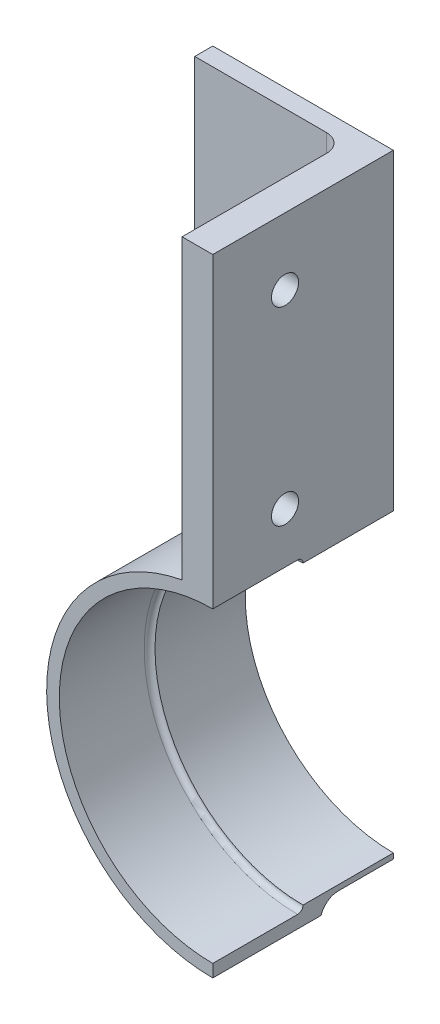
from build123d import *

# Parameters (mm, degrees)
BOSS_EXTRUDE1_DEPTH     = 2.5399999999999996
BOSS_EXTRUDE3_DEPTH     = 12.7
BOSS_EXTRUDE6_DEPTH     = 2.54
BOSS_EXTRUDE7_DEPTH     = 25.4
BOSS_EXTRUDE8_START     = 10.16
BOSS_EXTRUDE8_DEPTH     = 15.239999999999998
FILLET1_R               = 2.5399999999999996
FILLET2_ANGLE           = 169.351542
FILLET3_R               = 0.762
CUT_EXTRUDE1_DEPTH      = 93.8296161634462
CUT_EXTRUDE1_DEPTH_BACK = 93.8296161634462
SKETCH3_R               = 1.9050000000000038
SKETCH3_R_2             = 1.9049999999999983


with BuildPart() as part:
    # Sketch2 → Boss-Extrude1 (new body)
    with BuildSketch(Plane.XY):
        with BuildLine():
            Line((0, 85.598), (0, 0))
            Line((0, 0), (14.804819963776673, 1e-17))
            ThreePointArc((14.804819963776595, -3.0553e-13), (2.268412192290537, 24.14357981267628), (21.081999999999496, 43.793589476431805))
            Line((21.082000000000004, 43.79358947643172), (21.082, 85.598))
            Line((21.082, 85.598), (0, 85.598))
        make_face()
    extrude(amount=BOSS_EXTRUDE1_DEPTH)



with BuildPart() as body_2:
    # Sketch2<4> → Boss-Extrude3 (new body)
    with BuildSketch(Plane.XY):
        with BuildLine():
            ThreePointArc((21.082000000000008, 41.98179341867554), (3.82144132339004, 21.53078406363614), (19.714710561456986, 2.0606e-13))
            Line((19.714710561456965, 2e-17), (25.399999983196594, 2e-17))
            ThreePointArc((25.399999983196587, -3.55e-15), (4.685437224641706, 18.657176878292418), (21.082000000000004, 41.20348674265231))
            Line((21.082000000000004, 41.20348674265231), (21.082000000000004, 41.98179341867554))
        make_face()
        with BuildLine():
            ThreePointArc((25.400000000000105, 42.418000000000006), (23.230011510307612, 42.30867154338064), (21.082000000000008, 41.98179341867554))
            Line((21.082000000000004, 41.98179341867554), (21.082000000000004, 41.20348674265231))
            ThreePointArc((21.082000000000004, 41.20348674265231), (23.229176869936293, 41.542562774482604), (25.39999999999965, 41.656000000000006))
            Line((25.400000000000002, 41.656000000000006), (25.400000000000002, 42.418000000000006))
        make_face()
        with BuildLine():
            Line((25.399999983196594, 2e-17), (19.714710561456965, 2e-17))
            ThreePointArc((19.714710561456986, 2.0606e-13), (22.531936193178055, -0.5706520603518008), (25.4000000000001, -0.7620000000000076))
            Line((25.40000000000001, -0.7620000000000147), (25.40000000000001, 0))
        make_face()
    extrude(amount=BOSS_EXTRUDE3_DEPTH)


with BuildPart() as part_1:
    add(part.part)

    add(body_2.part)  # Boss-Extrude6 merges body 2
    # Sketch2<9> → Boss-Extrude6 (add)
    with BuildSketch(Plane.XY):
        with BuildLine():
            ThreePointArc((21.081999999999496, 43.793589476431805), (2.268412192290537, 24.14357981267628), (14.804819963776595, -3.0553e-13))
            Line((14.804819963776673, 1e-17), (19.714710561456965, 2e-17))
            ThreePointArc((19.714710561456986, 2.0606e-13), (3.82144132339004, 21.53078406363614), (21.082000000000008, 41.98179341867554))
            Line((21.082000000000004, 41.98179341867554), (21.082000000000004, 43.79358947643172))
        make_face()
    extrude(amount=BOSS_EXTRUDE6_DEPTH)

    # Sketch2<10> → Boss-Extrude7 (add)
    with BuildSketch(Plane.XY):
        with BuildLine():
            Line((25.4, 85.598), (21.082, 85.598))
            Line((21.082, 85.598), (21.082000000000004, 43.79358947643172))
            ThreePointArc((21.081999999999496, 43.793589476431805), (23.231644734511608, 44.095179877299884), (25.39999999999975, 44.196))
            Line((25.400000000000002, 44.196), (25.4, 85.598))
        make_face()
        with BuildLine():
            ThreePointArc((25.39999999999975, 44.196), (23.231644734511608, 44.095179877299884), (21.081999999999496, 43.793589476431805))
            Line((21.082000000000004, 43.79358947643172), (21.082000000000004, 41.98179341867554))
            ThreePointArc((21.082000000000008, 41.98179341867554), (23.230011510307612, 42.30867154338064), (25.400000000000105, 42.418000000000006))
            Line((25.400000000000002, 42.418000000000006), (25.400000000000002, 44.196))
        make_face()
    extrude(amount=BOSS_EXTRUDE7_DEPTH)

    # Sketch2<12> → Boss-Extrude8 (add)
    with BuildSketch(Plane.XY.offset(BOSS_EXTRUDE8_START)):
        with BuildLine():
            Line((19.714710561456965, 2e-17), (14.804819963776673, 1e-17))
            ThreePointArc((14.804819963776595, -3.0553e-13), (19.952306910260432, -1.8961295542866416), (25.400000000000006, -2.539999999999999))
            Line((25.40000000000001, -2.5400000000000063), (25.40000000000001, -0.7620000000000147))
            ThreePointArc((25.4000000000001, -0.7620000000000076), (22.531936193178055, -0.5706520603518008), (19.714710561456986, 2.0606e-13))
        make_face()
        with BuildLine():
            ThreePointArc((21.081999999999496, 43.793589476431805), (2.268412192290537, 24.14357981267628), (14.804819963776595, -3.0553e-13))
            Line((14.804819963776673, 1e-17), (19.714710561456965, 2e-17))
            ThreePointArc((19.714710561456986, 2.0606e-13), (3.82144132339004, 21.53078406363614), (21.082000000000008, 41.98179341867554))
            Line((21.082000000000004, 41.98179341867554), (21.082000000000004, 43.79358947643172))
        make_face()
    extrude(amount=BOSS_EXTRUDE8_DEPTH)

    # Fillet1
    fillet1_edges = [part_1.edges().sort_by_distance(p)[0] for p in [
        (21.082, 63.78989670933777, 2.5399999999999996),
        (3.8214413233900366, 21.530784063636144, 2.54),
    ]]
    fillet(fillet1_edges, radius=FILLET1_R)

    # Fillet2: read off the stored shape, not the designer's step
    # Fillet2 outline → Fillet2 (revolve)
    with BuildSketch(Plane(origin=(25.4, 20.828, 0), x_dir=(-0.1847826086956513, 0.982779419566583, 0), z_dir=(0.982779419566583, 0.1847826086956513, 0))):
        with BuildLine():
            ThreePointArc((21.59, 7.736994428), (22.082186532, 9.239678693), (23.368, 10.16))
            Line((23.368, 10.16), (21.59, 10.16))
            Line((21.59, 10.16), (21.59, 7.736994428))
        make_face()
    revolve(axis=Axis((25.4, 20.828, 0), (0, 0, 1)), revolution_arc=FILLET2_ANGLE)

    # Fillet3
    fillet3_edges = [part_1.edges().sort_by_distance(p)[0] for p in [
        (3.809999999999814, 20.827999999999818, 12.7),
    ]]
    fillet(fillet3_edges, radius=FILLET3_R - 0.0001)  # a hair under: the kernel refuses the full size

    # Sketch3 → Cut-Extrude1 (cut, two sides: drawn at the far end of the back side and taken through both)
    with BuildSketch(Plane(origin=(0, 0, 0), x_dir=(0, 0, -1), z_dir=(1, 0, 0)).offset(-CUT_EXTRUDE1_DEPTH_BACK)):
        with Locations(Location((-15.24, 76.2, 0), (0, 0, 90))):
            Circle(SKETCH3_R)
        with Locations(Location((-15.239999999999998, 49.53, 0), (0, 0, 90))):
            Circle(SKETCH3_R_2)
    extrude(amount=CUT_EXTRUDE1_DEPTH + CUT_EXTRUDE1_DEPTH_BACK, mode=Mode.SUBTRACT)


solid = part_1.part
